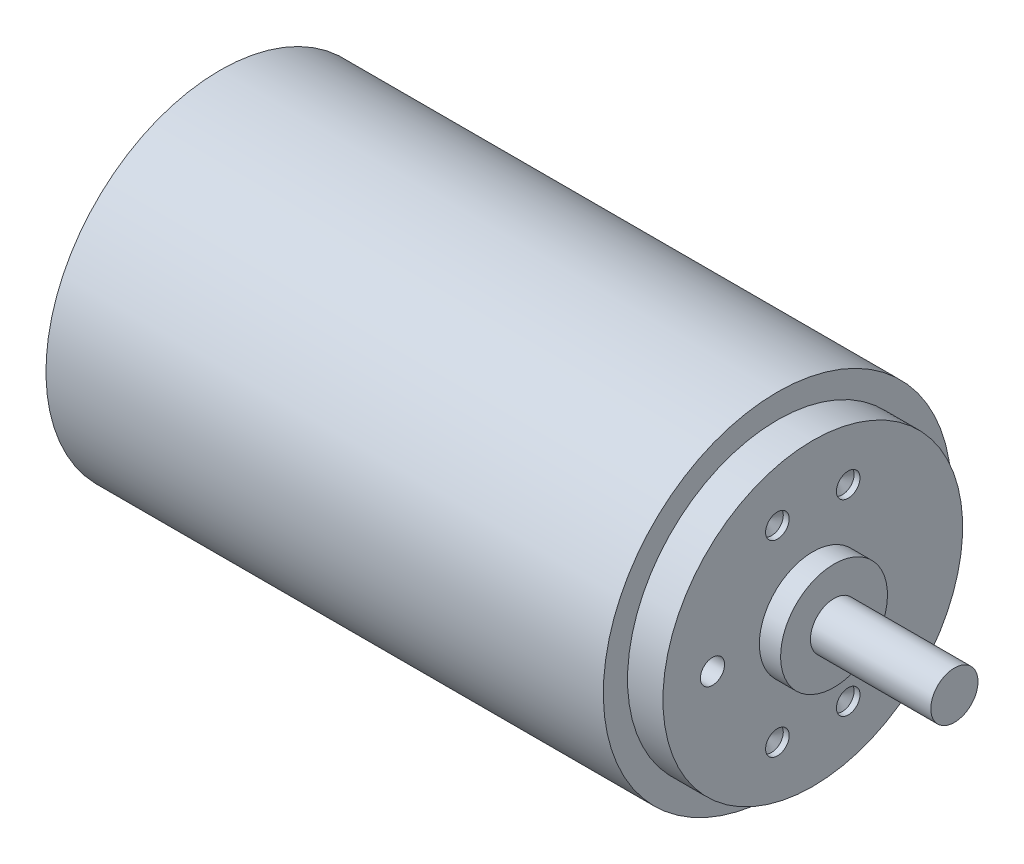
from build123d import *

# Parameters (mm, degrees)
F_4_0_4_DURCHMESSER_BOHRUNG1_D       = 4
F_4_0_4_DURCHMESSER_BOHRUNG1_DEPTH   = 1
F_4_0_4_DURCHMESSER_BOHRUNG1_TIP     = 1.201721238
F_4_1_4_1_DURCHMESSER_BOHRUNG1_D     = 4.1
F_4_1_4_1_DURCHMESSER_BOHRUNG1_DEPTH = 11.5
F_4_1_4_1_DURCHMESSER_BOHRUNG1_TIP   = 1.231764269


with BuildPart() as part:
    # Skizze1 → Rotation1 (revolve)
    with BuildSketch(Plane.XY):
        Polygon((-21.65112042, 29.5), (72.808848027, 29.5), (72.808848027, 25.397565661), (78.808848027, 25.397565661), (78.808848027, 9.053899077), (82.408848027, 9.053899077), (82.408848027, 4), (87.880820833, 4), (102.808848027, 4), (102.808848027, 0), (0, 0), (-39.191151973, 0), (-39.191151973, 4), (-30.191151973, 4), (-24.191151973, 5.693354369), (-24.191151973, 22.949681802), (-21.65112042, 22.949681802), align=None)
    revolve(axis=Axis((0, 0, 0), (-1, 0, 0)))

    # Ø4.0 (4) Durchmesser Bohrung1
    with Locations(Plane(origin=(78.808848027, 0, 0), x_dir=(0, 0, -1), z_dir=(1, 0, 0))):
        with Locations((-6, 15.905973721), (6, 15.905973721), (-6, -15.905973721), (6, -15.905973721)):
            Hole(F_4_0_4_DURCHMESSER_BOHRUNG1_D / 2, depth=F_4_0_4_DURCHMESSER_BOHRUNG1_DEPTH)
            with Locations((0, 0, -(F_4_0_4_DURCHMESSER_BOHRUNG1_DEPTH + F_4_0_4_DURCHMESSER_BOHRUNG1_TIP / 2))):  # 118° drill point
                Cone(0, F_4_0_4_DURCHMESSER_BOHRUNG1_D / 2, F_4_0_4_DURCHMESSER_BOHRUNG1_TIP, mode=Mode.SUBTRACT)

    # Ø4.1 (4.1) Durchmesser Bohrung1
    with Locations(Plane(origin=(78.808848027, 0, 0), x_dir=(0, 0, -1), z_dir=(1, 0, 0))):
        with Locations((-17, 0)):
            Hole(F_4_1_4_1_DURCHMESSER_BOHRUNG1_D / 2, depth=F_4_1_4_1_DURCHMESSER_BOHRUNG1_DEPTH)
            with Locations((0, 0, -(F_4_1_4_1_DURCHMESSER_BOHRUNG1_DEPTH + F_4_1_4_1_DURCHMESSER_BOHRUNG1_TIP / 2))):  # 118° drill point
                Cone(0, F_4_1_4_1_DURCHMESSER_BOHRUNG1_D / 2, F_4_1_4_1_DURCHMESSER_BOHRUNG1_TIP, mode=Mode.SUBTRACT)


solid = part.part
